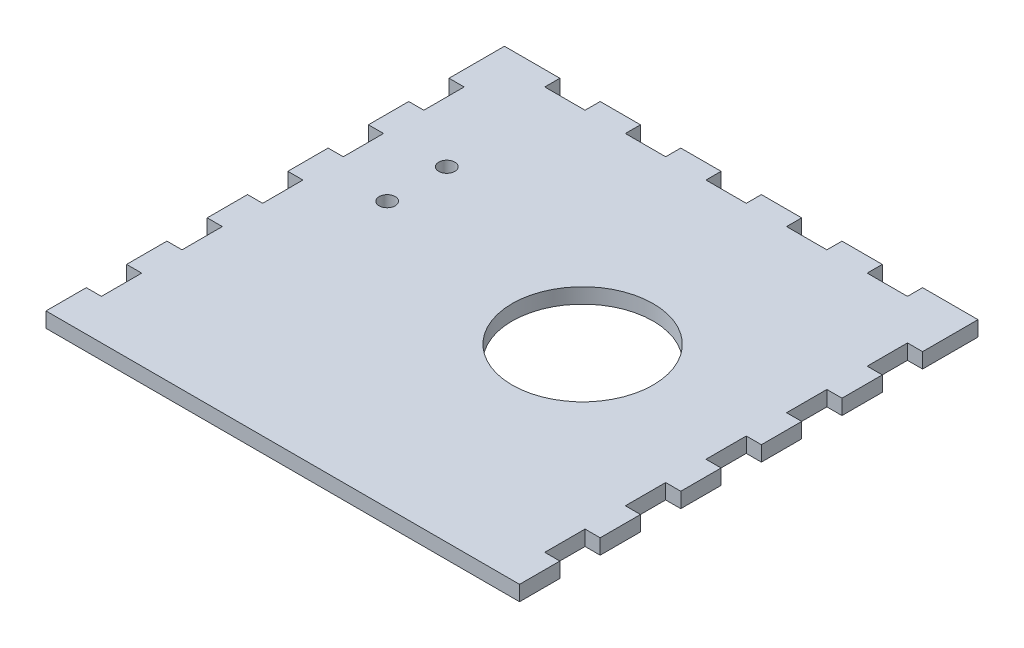
from build123d import *

# Parameters (mm, degrees)
SKETCH1_W               = 279.4
SKETCH1_H               = 279.4
BOSS_EXTRUDE1_DEPTH     = 9.525
SKETCH2_W               = 25.4
SKETCH2_H               = 9.525
BOSS_EXTRUDE2_DEPTH     = 9.525
LPATTERN1_COUNT         = 6
LPATTERN1_PITCH         = 50.8
MIRROR1_COPY_1_SKETCH_W = 25.4
MIRROR1_COPY_1_SKETCH_H = 9.525
MIRROR1_COPY_1_DEPTH    = 9.525
MIRROR1_COPY_2_SKETCH_W = 25.4
MIRROR1_COPY_2_SKETCH_H = 9.525
MIRROR1_COPY_2_DEPTH    = 9.525
MIRROR1_COPY_3_SKETCH_W = 25.4
MIRROR1_COPY_3_SKETCH_H = 9.525
MIRROR1_COPY_3_DEPTH    = 9.525
MIRROR1_COPY_4_SKETCH_W = 25.4
MIRROR1_COPY_4_SKETCH_H = 9.525
MIRROR1_COPY_4_DEPTH    = 9.525
MIRROR1_COPY_5_SKETCH_W = 25.4
MIRROR1_COPY_5_SKETCH_H = 9.525
MIRROR1_COPY_5_DEPTH    = 9.525
MIRROR1_COPY_6_SKETCH_W = 25.4
MIRROR1_COPY_6_SKETCH_H = 9.525
MIRROR1_COPY_6_DEPTH    = 9.525
SKETCH3_W               = 25.4
SKETCH3_H               = 9.525
BOSS_EXTRUDE3_DEPTH     = 9.525
LPATTERN2_COUNT         = 6
LPATTERN2_PITCH         = 50.8
SKETCH5_W               = 9.525
SKETCH5_H               = 9.525
BOSS_EXTRUDE4_DEPTH     = 9.525
SKETCH6_R               = 44.45
CUT_EXTRUDE1_DEPTH      = 212.250862424
SKETCH7_R               = 5.08
CUT_EXTRUDE2_DEPTH      = 212.250862424


with BuildPart() as part:
    # Sketch1 → Boss-Extrude1 (new body)
    with BuildSketch(Plane(origin=(0, 0, 0), x_dir=(1, 0, 0), z_dir=(0, 1, 0))):
        Rectangle(SKETCH1_W, SKETCH1_H)
    extrude(amount=BOSS_EXTRUDE1_DEPTH)

    # Sketch2 → Boss-Extrude2 (add)
    with BuildSketch(Plane(origin=(139.7, 0, 0), x_dir=(0, 0, -1), z_dir=(1, 0, 0))):
        with Locations((-127, 4.7625)):
            Rectangle(SKETCH2_W, SKETCH2_H)
    boss_extrude2 = extrude(amount=BOSS_EXTRUDE2_DEPTH)

    # LPattern1: Boss-Extrude2 ×6
    with Locations(*[(0, 0, -i * LPATTERN1_PITCH) for i in range(1, LPATTERN1_COUNT)]):
        add(boss_extrude2)

    # Mirror1 copy 1 sketch → Mirror1 copy 1 (add)
    with BuildSketch(Plane(origin=(-139.7, 0, -50.8), x_dir=(0, 0, -1), z_dir=(-1, 0, 0))):
        with Locations((-127, -4.7625)):
            Rectangle(MIRROR1_COPY_1_SKETCH_W, MIRROR1_COPY_1_SKETCH_H)
    extrude(amount=MIRROR1_COPY_1_DEPTH)

    # Mirror1 copy 2 sketch → Mirror1 copy 2 (add)
    with BuildSketch(Plane(origin=(-139.7, 0, -101.6), x_dir=(0, 0, -1), z_dir=(-1, 0, 0))):
        with Locations((-127, -4.7625)):
            Rectangle(MIRROR1_COPY_2_SKETCH_W, MIRROR1_COPY_2_SKETCH_H)
    extrude(amount=MIRROR1_COPY_2_DEPTH)

    # Mirror1 copy 3 sketch → Mirror1 copy 3 (add)
    with BuildSketch(Plane(origin=(-139.7, 0, -152.4), x_dir=(0, 0, -1), z_dir=(-1, 0, 0))):
        with Locations((-127, -4.7625)):
            Rectangle(MIRROR1_COPY_3_SKETCH_W, MIRROR1_COPY_3_SKETCH_H)
    extrude(amount=MIRROR1_COPY_3_DEPTH)

    # Mirror1 copy 4 sketch → Mirror1 copy 4 (add)
    with BuildSketch(Plane(origin=(-139.7, 0, -203.2), x_dir=(0, 0, -1), z_dir=(-1, 0, 0))):
        with Locations((-127, -4.7625)):
            Rectangle(MIRROR1_COPY_4_SKETCH_W, MIRROR1_COPY_4_SKETCH_H)
    extrude(amount=MIRROR1_COPY_4_DEPTH)

    # Mirror1 copy 5 sketch → Mirror1 copy 5 (add)
    with BuildSketch(Plane(origin=(-139.7, 0, -254), x_dir=(0, 0, -1), z_dir=(-1, 0, 0))):
        with Locations((-127, -4.7625)):
            Rectangle(MIRROR1_COPY_5_SKETCH_W, MIRROR1_COPY_5_SKETCH_H)
    extrude(amount=MIRROR1_COPY_5_DEPTH)

    # Mirror1 copy 6 sketch → Mirror1 copy 6 (add)
    with BuildSketch(Plane(origin=(-139.7, 0, 0), x_dir=(0, 0, -1), z_dir=(-1, 0, 0))):
        with Locations((-127, -4.7625)):
            Rectangle(MIRROR1_COPY_6_SKETCH_W, MIRROR1_COPY_6_SKETCH_H)
    extrude(amount=MIRROR1_COPY_6_DEPTH)

    # Sketch3 → Boss-Extrude3 (add)
    with BuildSketch(Plane(origin=(0, 0, -139.7), x_dir=(-1, 0, 0), z_dir=(0, 0, -1))):
        with Locations((-127, 4.7625)):
            Rectangle(SKETCH3_W, SKETCH3_H)
    boss_extrude3 = extrude(amount=BOSS_EXTRUDE3_DEPTH)

    # LPattern2: Boss-Extrude3 ×6
    with Locations(*[(-i * LPATTERN2_PITCH, 0, 0) for i in range(1, LPATTERN2_COUNT)]):
        add(boss_extrude3)

    # Sketch5 → Boss-Extrude4 (add)
    with BuildSketch(Plane(origin=(0, 0, -139.7), x_dir=(-1, 0, 0), z_dir=(0, 0, -1))):
        with Locations((-144.4625, 4.7625)):
            Rectangle(SKETCH5_W, SKETCH5_H)
    boss_extrude4 = extrude(amount=BOSS_EXTRUDE4_DEPTH)

    # Mirror2: Boss-Extrude4 across plane
    add(boss_extrude4.mirror(Plane(origin=(0, 0, 0), x_dir=(0, 0, 1), z_dir=(1, 0, 0))))

    # Sketch6 → Cut-Extrude1 (cut, through all)
    with BuildSketch(Plane(origin=(0, 9.525, 0), x_dir=(1, 0, 0), z_dir=(0, 1, 0))):
        with Locations((38.1, 11.176)):
            Circle(SKETCH6_R)
    extrude(amount=-CUT_EXTRUDE1_DEPTH, mode=Mode.SUBTRACT)

    # Sketch7 → Cut-Extrude2 (cut, through all)
    with BuildSketch(Plane(origin=(0, 9.525, 0), x_dir=(1, 0, 0), z_dir=(0, 1, 0))):
        with Locations((-101.6, 65.278)):
            Circle(SKETCH7_R)
        with Locations((-101.6, 27.686)):
            Circle(SKETCH7_R)
    extrude(amount=-CUT_EXTRUDE2_DEPTH, mode=Mode.SUBTRACT)


solid = part.part
